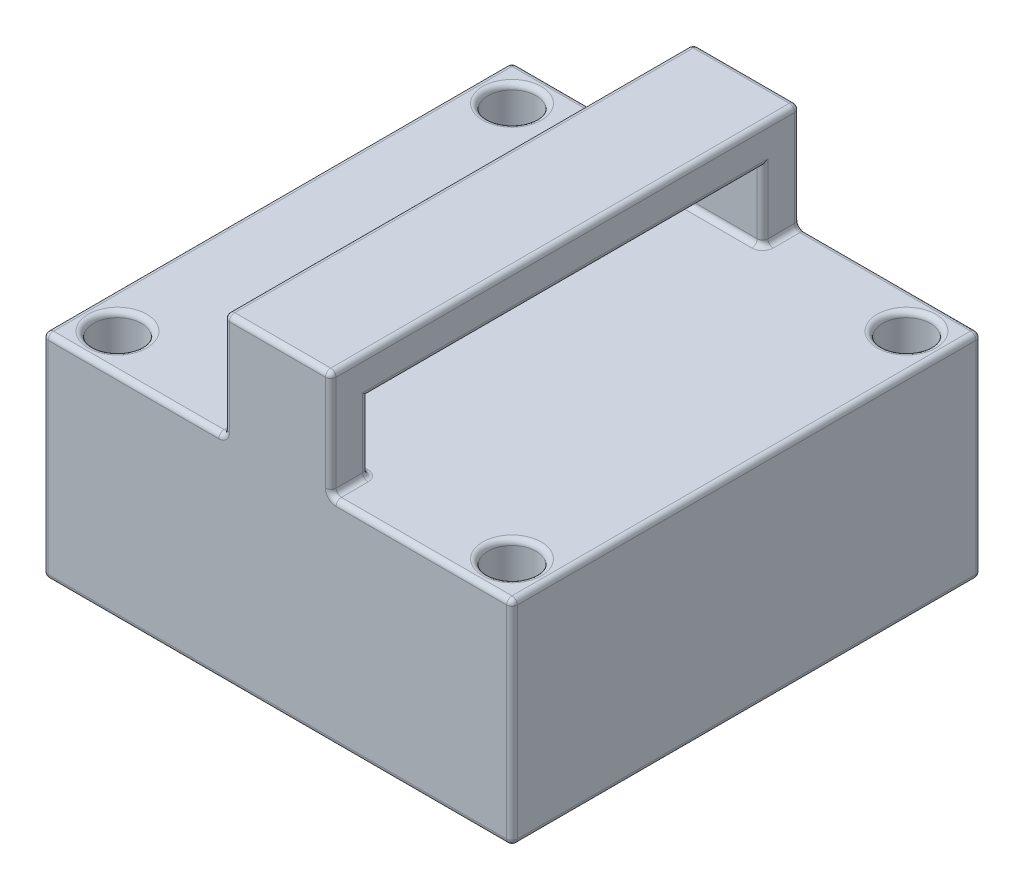
from build123d import *

# Parameters (mm, degrees)
SKETCH1_W                = 22
SKETCH1_H                = 22
SKETCH1_R                = 1.125
BOSS_EXTRUDE1_DEPTH      = 10
BOSS_EXTRUDE2_DEPTH      = 2.5
BOSS_EXTRUDE2_DEPTH_BACK = 2.5
FILLET1_R                = 0.25
FILLET2_R                = 0.25
SKETCH3_R                = 10
CUT_EXTRUDE1_DEPTH       = 3
SKETCH4_R                = 6
CUT_EXTRUDE2_DEPTH       = 0.25
CUT_EXTRUDE4_DEPTH       = 5.75
SKETCH6_W                = 14.1
SKETCH6_H                = 5.75
CUT_EXTRUDE5_DEPTH       = 10
CUT_EXTRUDE6_START       = -3
CUT_EXTRUDE6_DEPTH       = 3


# Read off the part's stored shape, not the designer's step: Cut-Extrude6
with BuildPart() as part:
    # Sketch1 → Boss-Extrude1 (new body)
    with BuildSketch(Plane(origin=(0, 0, 0), x_dir=(1, 0, 0), z_dir=(0, 1, 0))):
        with Locations((11, 11)):
            Rectangle(SKETCH1_W, SKETCH1_H)
        with Locations(Location((1.75, 20.25, 0), (0, 0, 270))):
            Circle(SKETCH1_R, mode=Mode.SUBTRACT)
        with Locations(Location((1.75, 1.75, 0), (0, 0, 270))):
            Circle(SKETCH1_R, mode=Mode.SUBTRACT)
        with Locations(Location((20.25, 1.75, 0), (0, 0, 90))):
            Circle(SKETCH1_R, mode=Mode.SUBTRACT)
        with Locations(Location((20.25, 20.25, 0), (0, 0, 90))):
            Circle(SKETCH1_R, mode=Mode.SUBTRACT)
    extrude(amount=BOSS_EXTRUDE1_DEPTH)

    # Sketch2 → Boss-Extrude2 (add, two sides: drawn at the far end of the back side and taken through both)
    with BuildSketch(Plane.ZY.offset(-11).offset(-BOSS_EXTRUDE2_DEPTH_BACK)):
        Polygon((-22, 10), (-22, 15), (0, 15), (0, 10), (-1.75, 10), (-1.75, 13.25), (-20.25, 13.25), (-20.25, 10), align=None)
    extrude(amount=BOSS_EXTRUDE2_DEPTH + BOSS_EXTRUDE2_DEPTH_BACK)

    # Fillet1
    fillet1_edges = [part.edges().sort_by_distance(p)[0] for p in [
        (17.75, 10, -22),
        (4.25, 10, -22),
        (17.75, 10, 0),
        (13.5, 11.625, -20.25),
        (11, 10, -20.25),
        (13.5, 10, -21.125),
        (8.5, 12.5, -22),
        (11, 15, -22),
        (8.5, 15, -11),
        (11, 15, 0),
        (8.5, 12.5, 0),
        (13.5, 10, -0.875),
        (11, 10, -1.75),
        (13.5, 11.625, -1.75),
        (13.5, 13.25, -11),
        (13.5, 12.5, -22),
        (13.5, 15, -11),
        (13.5, 12.5, 0),
        (8.5, 11.625, -20.25),
        (8.5, 13.25, -11),
        (8.5, 11.625, -1.75),
        (8.5, 10, -0.875),
        (8.5, 10, -21.125),
        (4.25, 10, 0),
    ]]
    fillet(fillet1_edges, radius=FILLET1_R)

    # Fillet2
    fillet2_edges = [part.edges().sort_by_distance(p)[0] for p in [
        (1.75, 10, -21.375),
        (1.75, 10, -2.875),
        (20.25, 10, -0.625),
        (20.25, 10, -19.125),
        (11, 0, -22),
        (22, 0, -11),
        (11, 0, 0),
        (0, 10, -11),
        (22, 10, -11),
        (0, 0, -11),
        (0, 4.875, -22),
        (22, 4.875, -22),
        (22, 4.875, 0),
        (22, 9.926776695, -0.073223305),
        (22, 9.926776695, -21.926776695),
        (0, 4.875, 0),
        (0, 9.926776695, -21.926776695),
        (0, 9.926776695, -0.073223305),
    ]]
    fillet(fillet2_edges, radius=FILLET2_R)

    # Sketch3 → Cut-Extrude1 (cut)
    with BuildSketch(Plane.XZ):
        with Locations(Location((11, -11, 0), (0, 0, 270))):
            Circle(SKETCH3_R)
    extrude(amount=-CUT_EXTRUDE1_DEPTH, mode=Mode.SUBTRACT)

    # Sketch4 → Cut-Extrude2 (cut)
    with BuildSketch(Plane.XZ.offset(-3)):
        with Locations(Location((11, -11, 0), (0, 0, 270))):
            Circle(SKETCH4_R)
    extrude(amount=-CUT_EXTRUDE2_DEPTH, mode=Mode.SUBTRACT)

    # Sketch5 → Cut-Extrude4 (cut)
    with BuildSketch(Plane(origin=(0, 9, 0), x_dir=(1, 0, 0), z_dir=(0, 1, 0))):
        with BuildLine():
            Line((11, 18.05), (0.25, 18.05))
            Line((0.25, 18.05), (0.25, 3.95))
            Line((0.25, 3.95), (11, 3.95))
            ThreePointArc((11, 3.95), (18.05, 11), (11, 18.05))
        make_face()
    extrude(amount=-CUT_EXTRUDE4_DEPTH, mode=Mode.SUBTRACT)

    # Sketch6 → Cut-Extrude5 (cut)
    with BuildSketch(Plane(origin=(0.25, 0, 0), x_dir=(0, 0, -1), z_dir=(1, 0, 0))):
        with Locations((11, 6.125)):
            Rectangle(SKETCH6_W, SKETCH6_H)
    extrude(amount=-CUT_EXTRUDE5_DEPTH, mode=Mode.SUBTRACT)

    # Cut-Extrude6 outline → Cut-Extrude6 (cut)
    with BuildSketch(Plane.XZ.offset(CUT_EXTRUDE6_START)):
        with BuildLine():
            Line((19, -22), (19, -17))
            ThreePointArc((19, -17), (11, -21), (3, -17))
            Line((3, -17), (3, -22))
            Line((3, -22), (19, -22))
        make_face()
    extrude(amount=CUT_EXTRUDE6_DEPTH, mode=Mode.SUBTRACT)


solid = part.part
